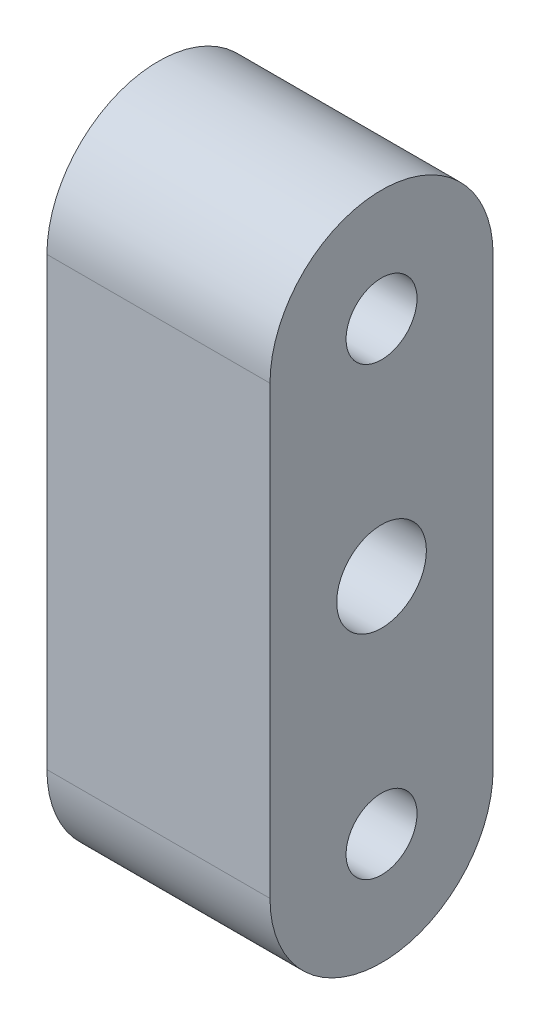
from build123d import *

# Parameters (mm, degrees)
BOSS_EXTRUDE1_DEPTH     = 12.7
F_1_4_20_TAPPED_HOLE1_D = 5.1054
F_10_32_TAPPED_HOLE1_D  = 4.0386


with BuildPart() as part:
    # Sketch1 → Boss-Extrude1 (new body)
    with BuildSketch(Plane(origin=(0, 0, 0), x_dir=(0, 0, -1), z_dir=(1, 0, 0))):
        with BuildLine():
            Line((6.35, 12.7), (6.35, -12.7))
            ThreePointArc((6.35, -12.7), (0, -19.05), (-6.35, -12.7))
            Line((-6.35, -12.7), (-6.35, 12.7))
            ThreePointArc((-6.35, 12.7), (0, 19.05), (6.35, 12.7))
        make_face()
    extrude(amount=BOSS_EXTRUDE1_DEPTH)

    # 1/4-20 Tapped Hole1 (through all)
    with Locations(Plane(origin=(12.7, 0, 0), x_dir=(0, 0, -1), z_dir=(1, 0, 0))):
        with Locations((0, 0)):
            Hole(F_1_4_20_TAPPED_HOLE1_D / 2)

    # #10-32 Tapped Hole1 (through all)
    with Locations(Plane(origin=(12.7, 0, 0), x_dir=(0, 0, -1), z_dir=(1, 0, 0))):
        with Locations((0, 12.7), (0, -12.7)):
            Hole(F_10_32_TAPPED_HOLE1_D / 2)


solid = part.part
